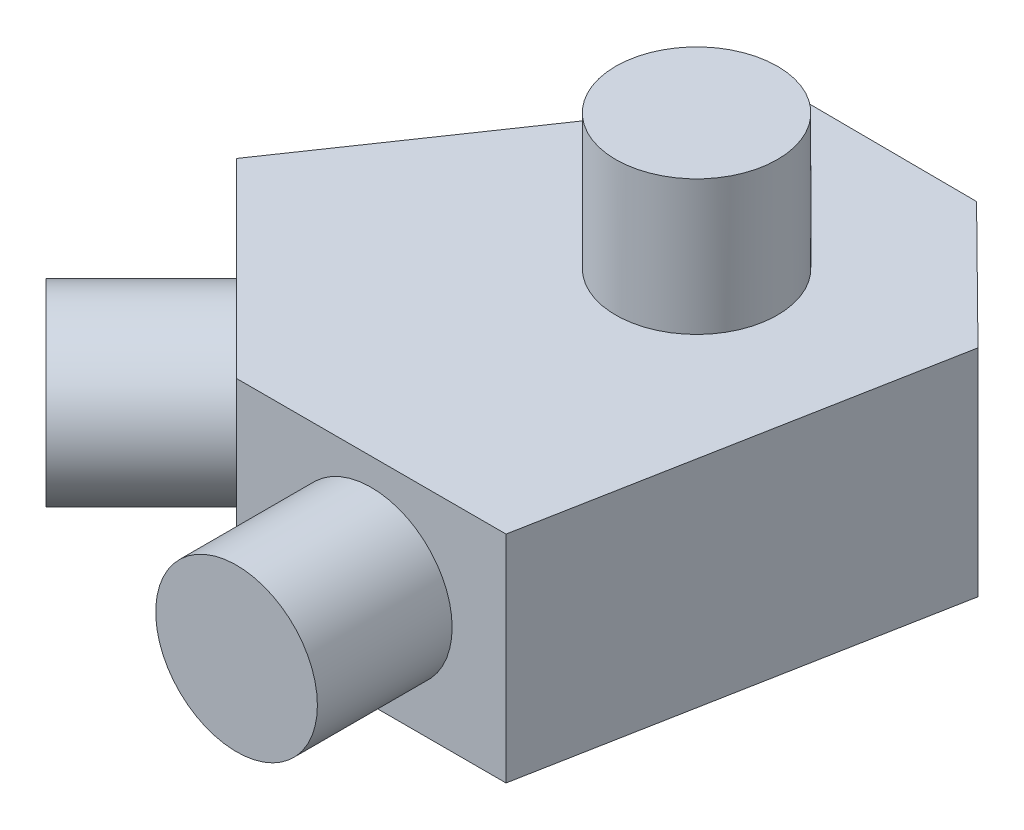
from build123d import *

# Parameters (mm, degrees)
BOSS_EXTRUDE1_DEPTH = 10.16
SKETCH2_R           = 3.81
BOSS_EXTRUDE2_DEPTH = 6.35
SKETCH5_R           = 3.81
BOSS_EXTRUDE3_DEPTH = 6.35


with BuildPart() as part:
    # Sketch1 → Boss-Extrude1 (new body)
    with BuildSketch(Plane(origin=(0, 0, 0), x_dir=(1, 0, 0), z_dir=(0, 1, 0))):
        Polygon((-8.980256121, 8.980256121), (0, 0), (12.7, 0), (16.220075072, 18.721954265), (10.214331376, 24.659577338), (1.769095743, 24.707745892), align=None)
    extrude(amount=BOSS_EXTRUDE1_DEPTH)

    # Sketch2 → Boss-Extrude2 (add)
    with BuildSketch(Plane.XY):
        with Locations((6.35, 5.08)):
            Circle(SKETCH2_R)
    boss_extrude2 = extrude(amount=BOSS_EXTRUDE2_DEPTH)

    # Mirror1: Boss-Extrude2 across plane
    add(boss_extrude2.mirror(Plane(origin=(0, 0, 0), x_dir=(-0.3826834323650866, 0, 0.9238795325112882), z_dir=(0.9238795325112881, 0, 0.38268343236508656))))

    # Sketch5 → Boss-Extrude3 (add)
    with BuildSketch(Plane(origin=(0, 10.16, 0), x_dir=(1, 0, 0), z_dir=(0, 1, 0))):
        with Locations((6.35, 15.330256121)):
            Circle(SKETCH5_R)
    extrude(amount=BOSS_EXTRUDE3_DEPTH)


solid = part.part
